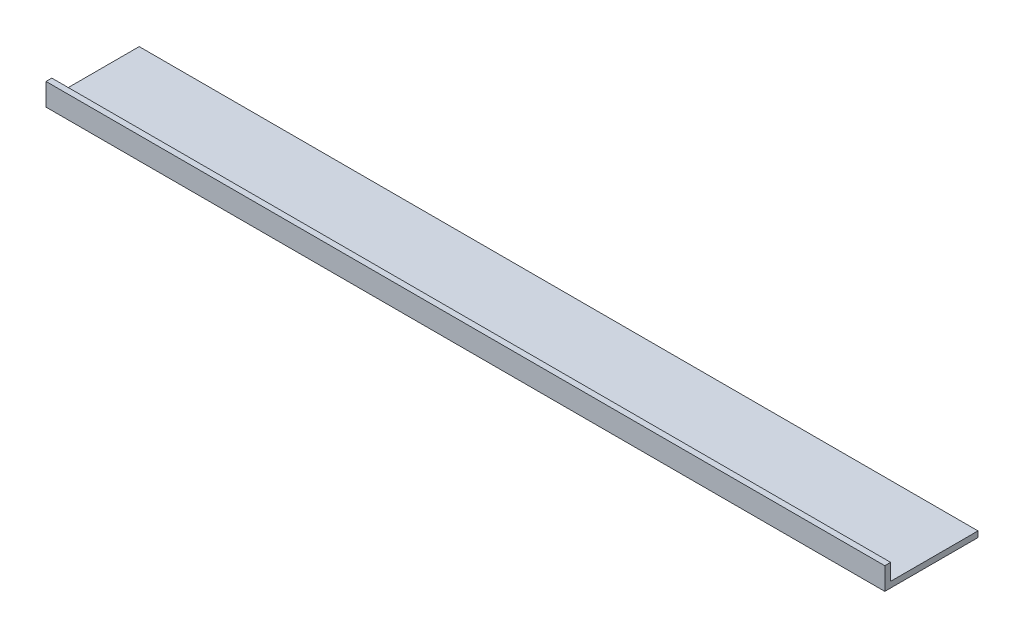
from build123d import *

# Parameters (mm, degrees)
SKETCH1_W           = 50.8
SKETCH1_H           = 12.13231
BOSS_EXTRUDE1_DEPTH = 457.2
CUT_EXTRUDE1_DEPTH  = 457.2


with BuildPart() as part:
    # Sketch1 → Boss-Extrude1 (new body)
    with BuildSketch(Plane(origin=(0, 0, 0), x_dir=(0, 0, -1), z_dir=(1, 0, 0))):
        with Locations((25.4, 6.066155)):
            Rectangle(SKETCH1_W, SKETCH1_H)
    extrude(amount=BOSS_EXTRUDE1_DEPTH)

    # Sketch2 → Cut-Extrude1 (cut)
    with BuildSketch(Plane.ZY):
        Polygon((-41.275, 12.13231), (-3.175, 12.13231), (-3.175, 3.175), (-41.275, 3.175), (-50.8, 3.175), (-50.8, 12.13231), align=None)
    extrude(amount=-CUT_EXTRUDE1_DEPTH, mode=Mode.SUBTRACT)


solid = part.part
